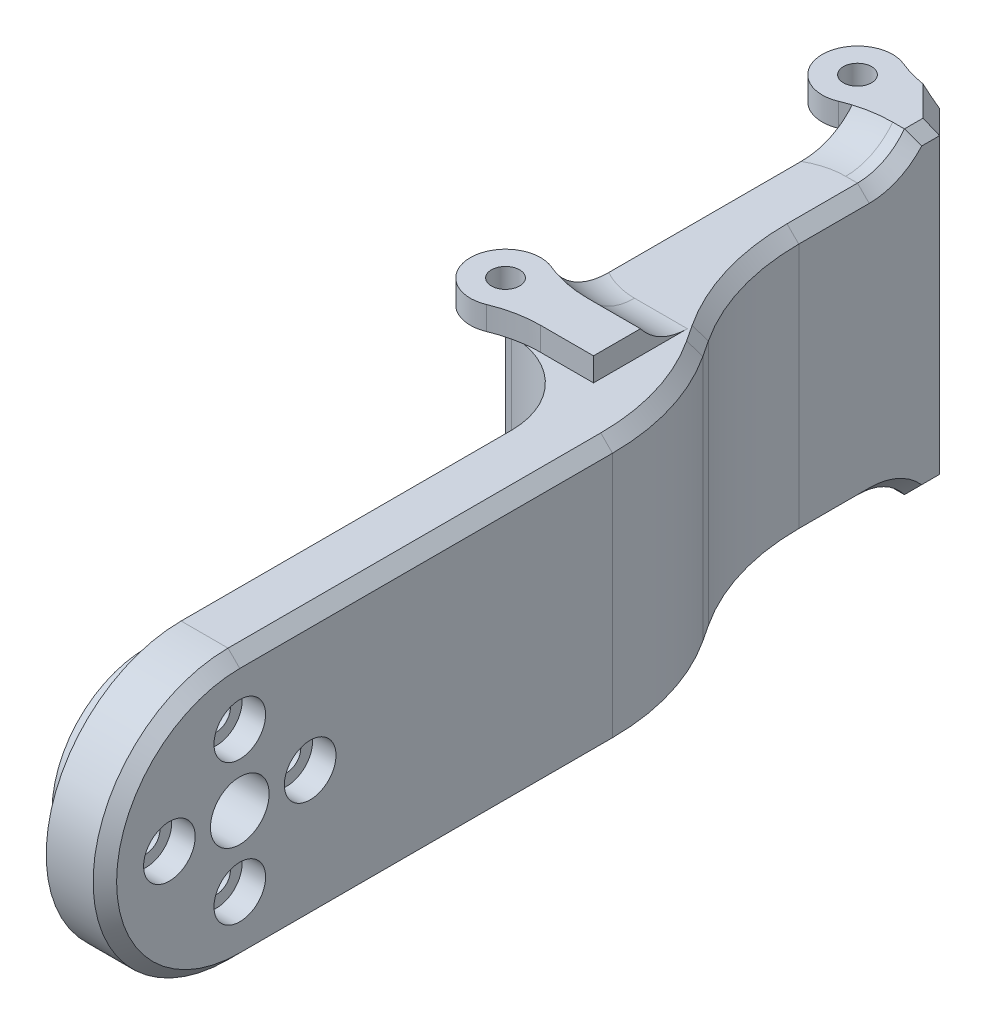
from build123d import *

# Parameters (mm, degrees)
SKETCH1_R                      = 2.5
BOSS_EXTRUDE1_DEPTH            = 5
SKETCH7_R                      = 8
BOSS_EXTRUDE4_DEPTH            = 3
CBORE_FOR_M2_SHCS1_D           = 2.4
CBORE_FOR_M2_SHCS1_CBORE_D     = 4.4
CBORE_FOR_M2_SHCS1_CBORE_DEPTH = 2
SKETCH4_W                      = 34
SKETCH4_H                      = 23
BOSS_EXTRUDE2_DEPTH            = 7.5
SKETCH5_W                      = 7.5
SKETCH5_H                      = 4
SKETCH5_R                      = 1.2
BOSS_EXTRUDE3_DEPTH            = 2
CUT_EXTRUDE1_DEPTH             = 75.423192322
CUT_EXTRUDE1_DEPTH_BACK        = 75.423192322
SKETCH8_R                      = 3
SKETCH8_R_2                    = 1.2
BOSS_EXTRUDE5_DEPTH            = 2
FILLET4_R                      = 10
FILLET2_R                      = 20
FILLET3_R                      = 5
FILLET5_R                      = 7
CHAMFER4_SIZE                  = 2
CHAMFER1_SIZE                  = 1


with BuildPart() as part:
    # Sketch1 → Boss-Extrude1 (new body)
    with BuildSketch(Plane(origin=(0, 0, 0), x_dir=(0, 0, -1), z_dir=(1, 0, 0))):
        with BuildLine():
            ThreePointArc((0, 11.5), (-11.5, 0), (0, -11.5))
            Line((0, -11.5), (69.148836254, -11.5))
            Line((69.148836254, -11.5), (69.148836254, 11.5))
            Line((69.148836254, 11.5), (0, 11.5))
        make_face()
        Circle(SKETCH1_R, mode=Mode.SUBTRACT)
    extrude(amount=BOSS_EXTRUDE1_DEPTH)

    # Sketch7 → Boss-Extrude4 (add)
    with BuildSketch(Plane.ZY):
        Circle(SKETCH7_R)
    extrude(amount=BOSS_EXTRUDE4_DEPTH)

    # CBORE for M2 SHCS1 (through all)
    with Locations(Plane(origin=(5, 0, 0), x_dir=(0, 0, -1), z_dir=(1, 0, 0))):
        with Locations((-6, 0), (0, 6), (6, 0), (0, -6)):
            CounterBoreHole(CBORE_FOR_M2_SHCS1_D / 2, CBORE_FOR_M2_SHCS1_CBORE_D / 2, CBORE_FOR_M2_SHCS1_CBORE_DEPTH)

    # Sketch4 → Boss-Extrude2 (add)
    with BuildSketch(Plane.ZY):
        with Locations((-52.148836254, 0)):
            Rectangle(SKETCH4_W, SKETCH4_H)
    extrude(amount=BOSS_EXTRUDE2_DEPTH)

    # Sketch5 → Boss-Extrude3 (add)
    # profile 1 of 4: a face of its own
    with BuildSketch(Plane(origin=(0, 11.5, 0), x_dir=(1, 0, 0), z_dir=(0, 1, 0))):
        with Locations((-3.75, 37.148836254)):
            Rectangle(SKETCH5_W, SKETCH5_H)
    # profile 2 of 4: a face of its own
    with BuildSketch(Plane(origin=(0, 11.5, 0), x_dir=(1, 0, 0), z_dir=(0, 1, 0))):
        with BuildLine():
            Line((-7.5, 35.148836254), (-7.5, 39.148836254))
            Line((-7.5, 39.148836254), (-9.5, 39.148836254))
            ThreePointArc((-9.5, 39.148836254), (-11.5, 37.148836254), (-9.5, 35.148836254))
            Line((-9.5, 35.148836254), (-7.5, 35.148836254))
        make_face()
        with Locations(Location((-9.5, 37.148836254, 0), (0, 0, 270))):
            Circle(SKETCH5_R, mode=Mode.SUBTRACT)
    # profile 3 of 4: a face of its own
    with BuildSketch(Plane(origin=(0, 11.5, 0), x_dir=(1, 0, 0), z_dir=(0, 1, 0))):
        with Locations((-3.75, 67.148836254)):
            Rectangle(SKETCH5_W, SKETCH5_H)
    # profile 4 of 4: a face of its own
    with BuildSketch(Plane(origin=(0, 11.5, 0), x_dir=(1, 0, 0), z_dir=(0, 1, 0))):
        with BuildLine():
            Line((-7.5, 69.148836254), (-9.5, 69.148836254))
            ThreePointArc((-9.5, 69.148836254), (-11.5, 67.148836254), (-9.5, 65.148836254))
            Line((-9.5, 65.148836254), (-7.5, 65.148836254))
            Line((-7.5, 65.148836254), (-7.5, 69.148836254))
        make_face()
        with Locations(Location((-9.5, 67.148836254, 0), (0, 0, 270))):
            Circle(SKETCH5_R, mode=Mode.SUBTRACT)
    boss_extrude3 = extrude(amount=BOSS_EXTRUDE3_DEPTH)

    # Mirror1: Boss-Extrude3 across plane
    add(boss_extrude3.mirror(Plane.ZX))

    # Sketch6 → Cut-Extrude1 (cut, two sides: drawn at the far end of the back side and taken through both)
    with BuildSketch(Plane(origin=(0, 11.5, 0), x_dir=(1, 0, 0), z_dir=(0, 1, 0)).offset(-CUT_EXTRUDE1_DEPTH_BACK)):
        Polygon((-2.5, 69.148836254), (-2.5, 49.148836254), (5, 37.762357558), (5, 69.148836254), align=None)
    extrude(amount=CUT_EXTRUDE1_DEPTH + CUT_EXTRUDE1_DEPTH_BACK, mode=Mode.SUBTRACT)

    # Sketch8 → Boss-Extrude5 (add)
    # profile 1 of 2: a face of its own
    with BuildSketch(Plane(origin=(0, 13.5, 0), x_dir=(1, 0, 0), z_dir=(0, 1, 0))):
        with Locations((-9.5, 67.148836254)):
            Circle(SKETCH8_R)
        with Locations(Location((-9.5, 67.148836254, 0), (0, 0, 270))):
            Circle(SKETCH8_R_2, mode=Mode.SUBTRACT)
    # profile 2 of 2: a face of its own
    with BuildSketch(Plane(origin=(0, 13.5, 0), x_dir=(1, 0, 0), z_dir=(0, 1, 0))):
        with Locations((-9.5, 37.148836254)):
            Circle(SKETCH8_R)
        with Locations(Location((-9.5, 37.148836254, 0), (0, 0, 270))):
            Circle(SKETCH8_R_2, mode=Mode.SUBTRACT)
    boss_extrude5 = extrude(amount=-BOSS_EXTRUDE5_DEPTH)

    # Mirror2: Boss-Extrude5 across plane
    add(boss_extrude5.mirror(Plane.ZX))

    # Fillet4
    # the kernel refuses this fillet: 10 mm, written as the material it adds along each edge
    with BuildSketch(Plane(origin=(-7.263932023, 11.5, -69.148836254), x_dir=(-0.8150795156467411, 0, -0.5793491030225851), z_dir=(0, 1, 0))) as fillet4_piece_1:
        with BuildLine():
            CenterArc((3.540666656, -9.752076695), FILLET4_R, 102.784910078, 22.619864948)
            Line((-2.252824374, -1.601281538), (0, 0))
            ThreePointArc((0, 0), (0.663874998, -0.074376992), (1.327749996, 0))
        make_face()
    extrude(amount=2)
    with BuildSketch(Plane(origin=(-7.263932023, 11.5, -65.148836254), x_dir=(-0.8150795156467449, 0, 0.5793491030225799), z_dir=(0, 1, 0))) as fillet4_piece_2:
        with BuildLine():
            CenterArc((3.540666656, 9.752076695), FILLET4_R, 234.595224974, 22.619864948)
            Line((-2.252824374, 1.601281538), (0, 0))
            ThreePointArc((0, 0), (0.663874998, 0.074376992), (1.327749996, 0))
        make_face()
    extrude(amount=2)
    with BuildSketch(Plane(origin=(-7.263932023, 11.5, -35.148836254), x_dir=(1, 0, 0), z_dir=(0, 1, 0))) as fillet4_piece_3:
        with BuildLine():
            CenterArc((2.763932023, -10), FILLET4_R, 90, 22.619864948)
            ThreePointArc((-1.082221824, -0.769230769), (-0.498020668, -0.445238547), (0, 0))
            Line((0, 0), (2.763932023, 0))
        make_face()
    extrude(amount=2)
    with BuildSketch(Plane(origin=(-7.263932023, 11.5, -39.148836254), x_dir=(1, 0, 0), z_dir=(0, 1, 0))) as fillet4_piece_4:
        with BuildLine():
            CenterArc((2.763932023, 10), FILLET4_R, 247.380135052, 22.619864948)
            ThreePointArc((-1.082221824, 0.769230769), (-0.498020668, 0.445238547), (0, 0))
            Line((0, 0), (2.763932023, 0))
        make_face()
    extrude(amount=2)

    # Fillet2
    fillet2_edges = [part.edges().sort_by_distance(p)[0] for p in [
        (5, 0, -37.762357558),
        (-2.5, 0, -49.148836254),
    ]]
    fillet(fillet2_edges, radius=FILLET2_R)

    # Fillet3
    # the kernel refuses this fillet: 5 mm, written as the material it adds along each edge
    with BuildSketch(Plane(origin=(-4.5, 11.5, -65.148836254), x_dir=(0, 0, 1), z_dir=(1, 0, 0))) as fillet3_piece_1:
        with BuildLine():
            CenterArc((4, -5), FILLET3_R, 90, 53.130102354)
            Line((0, -2), (-0.08, -1.94))
            ThreePointArc((-0.08, -1.94), (-0.1, -1), (-0.1, 0))
            Line((-0.1, 0), (0, 0.1))
            Line((0, 0.1), (4, 0.1))
            Line((4, 0.1), (4, 0))
        make_face()
    extrude(amount=2)
    with BuildSketch(Plane(origin=(0, 11.5, -39.148836254), x_dir=(0, 0, -1), z_dir=(-1, 0, 0))) as fillet3_piece_2:
        with BuildLine():
            CenterArc((4, -5), FILLET3_R, 90, 53.130102354)
            Line((0, -2), (-0.08, -1.94))
            ThreePointArc((-0.08, -1.94), (-0.1, -1), (-0.1, 0))
            Line((-0.1, 0), (0, 0.1))
            Line((0, 0.1), (4, 0.1))
            Line((4, 0.1), (4, 0))
        make_face()
    extrude(amount=4.5)
    with BuildSketch(Plane(origin=(0, -11.5, -39.148836254), x_dir=(0, 0, -1), z_dir=(-1, 0, 0))) as fillet3_piece_3_section:
        with BuildLine():
            CenterArc((4, 5), FILLET3_R, 216.869897646, 53.130102354)
            Line((0, 2), (-0.08, 1.94))
            ThreePointArc((-0.08, 1.94), (-0.1, 1), (-0.1, 0))
            Line((-0.1, 0), (0, -0.1))
            Line((0, -0.1), (4, -0.1))
            Line((4, -0.1), (4, 0))
        make_face()
    fillet3_piece_3 = extrude(amount=17.263932023, mode=Mode.PRIVATE)
    fillet3_piece_3 = split(fillet3_piece_3, bisect_by=Plane(origin=(-7.5, -12.009955516, -40.183316128), z_dir=(1, 0, 0)), keep=Keep.TOP, mode=Mode.PRIVATE)
    add(fillet3_piece_3)
    with BuildSketch(Plane(origin=(-17.263932023, -11.5, -65.148836254), x_dir=(0, 0, 1), z_dir=(1, 0, 0))) as fillet3_piece_4_section:
        with BuildLine():
            CenterArc((4, 5), FILLET3_R, 216.869897646, 53.130102354)
            Line((0, 2), (-0.08, 1.94))
            ThreePointArc((-0.08, 1.94), (-0.1, 1), (-0.1, 0))
            Line((-0.1, 0), (0, -0.1))
            Line((0, -0.1), (4, -0.1))
            Line((4, -0.1), (4, 0))
        make_face()
    fillet3_piece_4 = extrude(amount=14.763932023, mode=Mode.PRIVATE)
    fillet3_piece_4 = split(fillet3_piece_4, bisect_by=Plane(origin=(-7.5, -12.00895453, -64.111805958), z_dir=(1, 0, 0)), keep=Keep.TOP, mode=Mode.PRIVATE)
    add(fillet3_piece_4)
    with BuildSketch(Plane(origin=(-4.5, 11.5, -55.148836254), x_dir=(0, 0, -1), z_dir=(1, 0, 0))) as fillet3_piece_5_section:
        with BuildLine():
            CenterArc((6, 5), FILLET3_R, 270, 53.130102354)
            Line((10, 2), (10.08, 1.94))
            ThreePointArc((10.08, 1.94), (10.1, 1), (10.1, 0))
            Line((10.1, 0), (10, -0.1))
            Line((10, -0.1), (6, -0.1))
            Line((6, -0.1), (6, 0))
        make_face()
    fillet3_piece_5 = revolve(axis=Axis((-4.5, 11.5, -55.148836254), (0, 1, 0)), revolution_arc=74.754248402, mode=Mode.PRIVATE)
    fillet3_piece_5 = split(fillet3_piece_5, bisect_by=Plane(origin=(-7.5, 12.098438569, -64.092030739), z_dir=(1, 0, 0)), keep=Keep.TOP, mode=Mode.PRIVATE)
    add(fillet3_piece_5)
    with BuildSketch(Plane(origin=(-4.5, 11.5, -49.148836254), x_dir=(-0.9648068245723973, 0, 0.2629596761074353), z_dir=(-0.2629596761074353, 0, -0.9648068245723973))) as fillet3_piece_6_section:
        with BuildLine():
            CenterArc((6, 5), FILLET3_R, 270, 53.130102354)
            Line((10, 2), (10.08, 1.94))
            ThreePointArc((10.08, 1.94), (10.1, 1), (10.1, 0))
            Line((10.1, 0), (10, -0.1))
            Line((10, -0.1), (6, -0.1))
            Line((6, -0.1), (6, 0))
        make_face()
    fillet3_piece_6 = revolve(axis=Axis((-4.5, 11.5, -49.148836254), (0, 1, 0)), revolution_arc=74.754248402, mode=Mode.PRIVATE)
    fillet3_piece_6 = split(fillet3_piece_6, bisect_by=Plane(origin=(-7.5, 12.098438572, -40.205641877), z_dir=(1, 0, 0)), keep=Keep.TOP, mode=Mode.PRIVATE)
    add(fillet3_piece_6)

    # Fillet5
    # the kernel refuses this fillet: 7 mm, written as the material it adds along each edge
    with BuildSketch(Plane(origin=(0, 11.5, -35.148836254), x_dir=(-1, 0, 0), z_dir=(0, -1, 0))) as fillet5_piece_1:
        with BuildLine():
            CenterArc((FILLET5_R, -FILLET5_R), FILLET5_R, 90, 90)
            Line((0, -FILLET5_R), (0, 0))
            Line((0, 0), (FILLET5_R, 0))
        make_face()
    extrude(amount=23)

    # Chamfer4
    chamfer4_edges = [part.edges().sort_by_distance(p)[0] for p in [
        (-2.5, 0, -69.148836254),
    ]]
    chamfer(chamfer4_edges, length=CHAMFER4_SIZE)

    # Chamfer1
    chamfer1_edges = [part.edges().sort_by_distance(p)[0] for p in [
        (5, 0, 11.5),
        (5, -11.5, -15.883704246),
        (5, 11.5, -15.883704246),
        (1.25, 11.5, -43.455596906),
        (1.25, -11.5, -43.455596906),
        (4.15785682, -11.5, -37.509927284),
        (4.15785682, 11.5, -37.509927284),
        (-1.65785682, 11.5, -49.401266528),
        (-1.65785682, -11.5, -49.401266528),
        (-2.5, 11.5, -58.146310787),
        (-2.5, -11.5, -58.146310787),
        (-2.5, -12.027864045, -63.384904232),
        (-2.5, 12.027864045, -63.384904232),
        (-2.5, 13.5, -66.148836254),
        (-2.5, -13.5, -66.148836254),
        (-3.5, 13.5, -68.148836254),
        (-3.5, -13.5, -68.148836254),
    ]]
    chamfer(chamfer1_edges, length=CHAMFER1_SIZE)


solid = part.part
